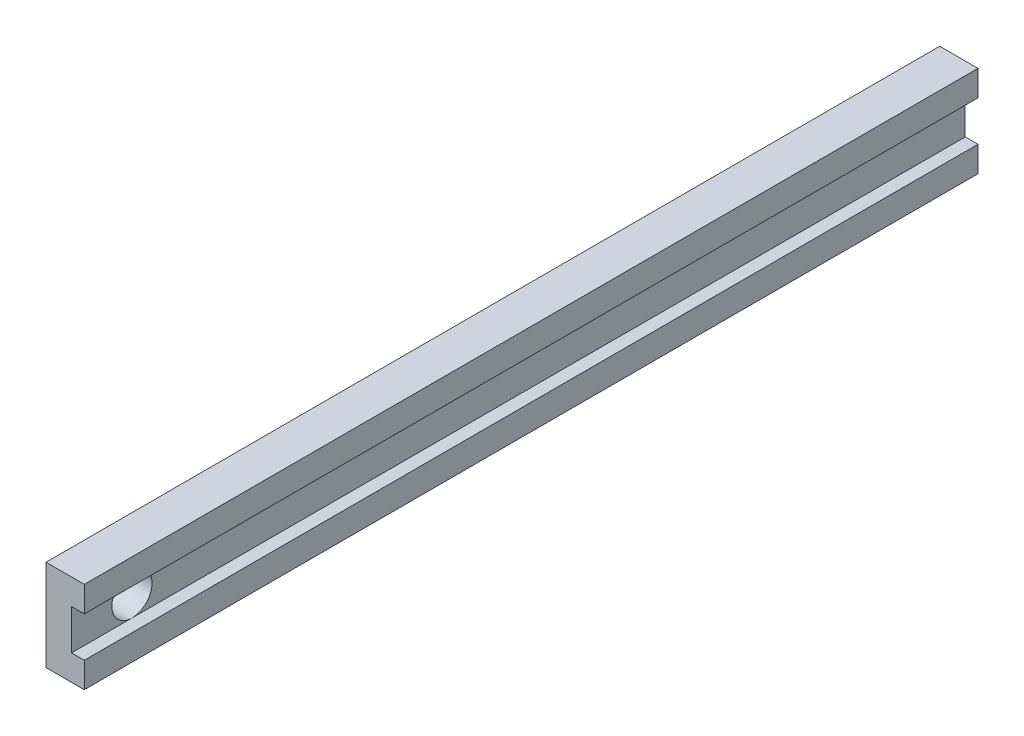
from build123d import *

# Parameters (mm, degrees)
BOSS_EXTRUDE1_DEPTH   = 177.8
F_8_0MM_DOWEL_HOLE1_D = 8


with BuildPart() as part:
    # Sketch1 → Boss-Extrude1 (new body)
    with BuildSketch(Plane.XY):
        Polygon((0, -5.318754457), (0, -13.318754457), (2.54, -13.318754457), (2.54, -18.398754457), (-5.08, -18.398754457), (-5.08, -0.238754457), (2.54, -0.238754457), (2.54, -5.318754457), align=None)
    extrude(amount=BOSS_EXTRUDE1_DEPTH)

    # Ø8.0mm Dowel Hole1 (through all)
    with Locations(Plane.ZY.offset(5.08)):
        with Locations((165.781898395, -9.318754457)):
            Hole(F_8_0MM_DOWEL_HOLE1_D / 2)


solid = part.part
